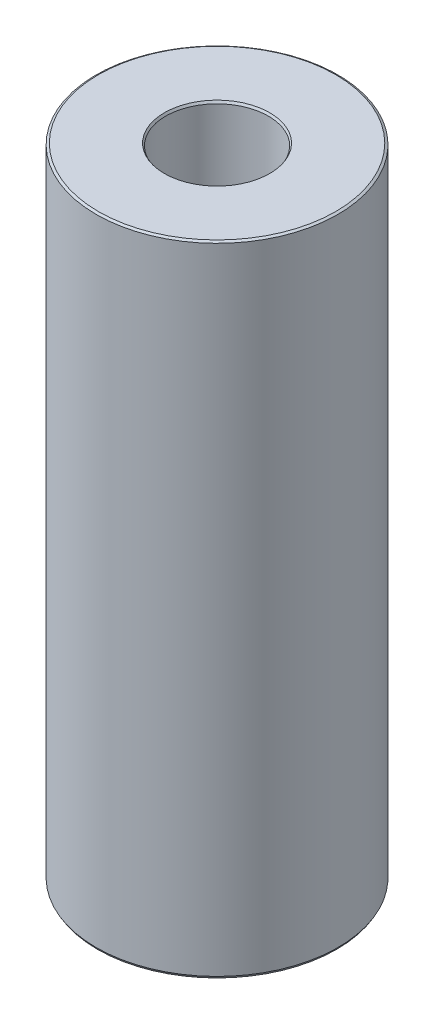
from build123d import *
from OCP.BRepFilletAPI import BRepFilletAPI_MakeChamfer

# Parameters (mm, degrees)
SKETCH1_R           = 55
BOSS_EXTRUDE1_DEPTH = 290.506111423
SKETCH2_R           = 23.375459639
CUT_EXTRUDE1_DEPTH  = 301.738758351
CHAMFER1_SIZE       = 0.5964517
CHAMFER1_SIZE2      = 1.033084649


with BuildPart() as part:
    # Sketch1 → Boss-Extrude1 (new body)
    with BuildSketch(Plane(origin=(0, 0, 0), x_dir=(1, 0, 0), z_dir=(0, 1, 0))):
        Circle(SKETCH1_R)
    extrude(amount=BOSS_EXTRUDE1_DEPTH)

    # Sketch2 → Cut-Extrude1 (cut, through all)
    with BuildSketch(Plane(origin=(0, 0, 0), x_dir=(1, 0, 0), z_dir=(0, 1, 0))):
        Circle(SKETCH2_R)
    extrude(amount=CUT_EXTRUDE1_DEPTH, mode=Mode.SUBTRACT)

    # Chamfer1: one chamfer whose edges measure the first distance from different faces: ONE call of the kernel's chamfer builder (chamfer() names one face for all edges)
    chamfer1_edges_1 = [part.edges().sort_by_distance(p)[0] for p in [
        (-23.375459639, 290.506111423, 0),
    ]]
    chamfer1_side_1 = [part.faces().sort_by_distance(p)[0] for p in [
        (-53.444365081, 290.506111423, 0),
    ]]
    chamfer1_edges_2 = [part.edges().sort_by_distance(p)[0] for p in [
        (-23.375459639, 0, 0),
    ]]
    chamfer1_side_2 = [part.faces().sort_by_distance(p)[0] for p in [
        (-23.375459639, 145.253055712, 0),
    ]]
    chamfer1_edges_3 = [part.edges().sort_by_distance(p)[0] for p in [
        (-55, 0, 0),
    ]]
    chamfer1_side_3 = [part.faces().sort_by_distance(p)[0] for p in [
        (-53.444365081, 0, 0),
    ]]
    chamfer1_edges_4 = [part.edges().sort_by_distance(p)[0] for p in [
        (-55, 290.506111423, 0),
    ]]
    chamfer1_side_4 = [part.faces().sort_by_distance(p)[0] for p in [
        (-55, 145.253055712, 0),
    ]]
    chamfer1 = BRepFilletAPI_MakeChamfer(part.part.solid().wrapped)
    for e in chamfer1_edges_1:
        chamfer1.Add(CHAMFER1_SIZE, CHAMFER1_SIZE2, e.wrapped, chamfer1_side_1[0].wrapped)  # the first distance lies on this face
    for e in chamfer1_edges_2:
        chamfer1.Add(CHAMFER1_SIZE, CHAMFER1_SIZE2, e.wrapped, chamfer1_side_2[0].wrapped)  # the first distance lies on this face
    for e in chamfer1_edges_3:
        chamfer1.Add(CHAMFER1_SIZE, CHAMFER1_SIZE2, e.wrapped, chamfer1_side_3[0].wrapped)  # the first distance lies on this face
    for e in chamfer1_edges_4:
        chamfer1.Add(CHAMFER1_SIZE, CHAMFER1_SIZE2, e.wrapped, chamfer1_side_4[0].wrapped)  # the first distance lies on this face
    add(Compound.cast(chamfer1.Shape()), mode=Mode.REPLACE)


solid = part.part
